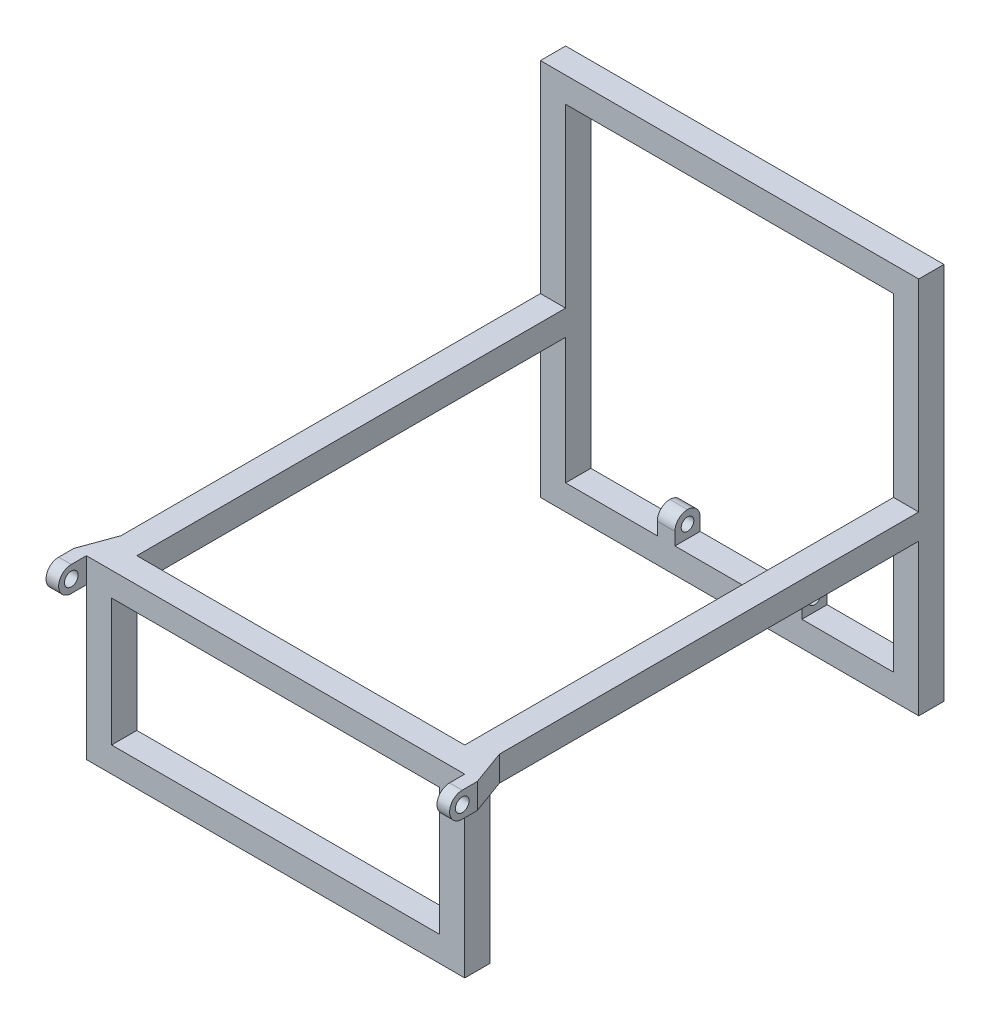
from build123d import *

# Parameters (mm, degrees)
SALIENTE_EXTRUIR1_DEPTH = 750
CORTAR_EXTRUIR4_REACH   = 2536.265
CROQUIS3_W              = 1300
CROQUIS3_H              = 1300
CORTAR_EXTRUIR5_REACH   = 2536.265
CROQUIS4_W              = 1300
CROQUIS4_H              = 504.649156168
CROQUIS5_R              = 27.184697772
SALIENTE_EXTRUIR2_DEPTH = 50
SALIENTE_EXTRUIR3_DEPTH = 100
CROQUIS8_R              = 27.1845
SALIENTE_EXTRUIR4_DEPTH = 50
SALIENTE_EXTRUIR5_DEPTH = 100
CROQUIS11_W             = 70
CROQUIS11_H             = 100
SALIENTE_EXTRUIR6_DEPTH = 100
REDONDEO1_R             = 50
CORTAR_EXTRUIR6_REACH   = 2735.316
CROQUIS12_R             = 25


with BuildPart() as part:
    # Croquis1 → Saliente-Extruir1 (new, symmetric)
    with BuildSketch(Plane(origin=(0, 0, 0), x_dir=(0, 0, -1), z_dir=(1, 0, 0))):
        Polygon((-100, 700), (-100, 1500), (0, 1500), (0, 0), (-100, 0), (-100, 600), (-1800, 600), (-1800, 0), (-1900, 0), (-1900, 600), (-1900, 700), align=None)
    extrude(amount=SALIENTE_EXTRUIR1_DEPTH, both=True)

    # Cortar-Extruir4: up to this face of the body (flat: up to its plane)
    cortar_extruir4_end = Plane(part.part.faces().sort_by_distance((0, 300, 1800))[0])
    # Croquis3 → Cortar-Extruir4 (cut, up to the picked face)
    with BuildSketch(Plane(origin=(0, 0, 0), x_dir=(-1, 0, 0), z_dir=(0, 0, -1)), mode=Mode.PRIVATE) as cortar_extruir4_sk1:
        with Locations((0, 750)):
            Rectangle(CROQUIS3_W, CROQUIS3_H)
    cortar_extruir4_tool1 = split(extrude(cortar_extruir4_sk1.sketch, amount=-CORTAR_EXTRUIR4_REACH, mode=Mode.PRIVATE), bisect_by=cortar_extruir4_end, keep=Keep.BOTH, mode=Mode.PRIVATE)
    add(cortar_extruir4_tool1.solids().sort_by(Axis((0, 750, 0), (0, 0, 1)))[0], mode=Mode.SUBTRACT)

    # Croquis4 → Cortar-Extruir5 (cut, up to next)
    with BuildSketch(Plane.XY.offset(1900), mode=Mode.PRIVATE) as cortar_extruir5_sk1:
        with Locations((0, 352.324578084)):
            Rectangle(CROQUIS4_W, CROQUIS4_H)
    cortar_extruir5_tool1 = extrude(cortar_extruir5_sk1.sketch, amount=-CORTAR_EXTRUIR5_REACH, mode=Mode.PRIVATE) & part.part
    add(cortar_extruir5_tool1.solids().sort_by_distance((0, 352.324578, 1900))[0], mode=Mode.SUBTRACT)



with BuildPart() as body_2:
    # Croquis5 → Saliente-Extruir2 (new body)
    with BuildSketch(Plane(origin=(750, 0, 0), x_dir=(0, 0, -1), z_dir=(1, 0, 0))):
        with BuildLine():
            Line((-1960, 600), (-1900, 600))
            Line((-1900, 600), (-1900, 700))
            Line((-1900, 700), (-1960, 700))
            ThreePointArc((-1960, 700), (-2010, 650), (-1960, 600))
        make_face()
        with Locations((-1960, 650)):
            Circle(CROQUIS5_R, mode=Mode.SUBTRACT)
    extrude(amount=SALIENTE_EXTRUIR2_DEPTH)


with BuildPart() as part_1:
    add(part.part)

    add(body_2.part)  # Saliente-Extruir3 merges body 2
    # Croquis6 → Saliente-Extruir3 (add)
    with BuildSketch(Plane(origin=(0, 700, 0), x_dir=(1, 0, 0), z_dir=(0, 1, 0))):
        Polygon((750, -1900), (800, -1900), (750, -1762.626129027), align=None)
    extrude(amount=-SALIENTE_EXTRUIR3_DEPTH)



with BuildPart() as body_2_2:
    # Croquis8 → Saliente-Extruir4 (new body)
    with BuildSketch(Plane.ZY.offset(750)):
        with BuildLine():
            Line((1960, 700), (1900, 700))
            Line((1900, 700), (1900, 600))
            Line((1900, 600), (1960, 600))
            ThreePointArc((1960, 600), (2010, 650), (1960, 700))
        make_face()
        with Locations((1960, 650)):
            Circle(CROQUIS8_R, mode=Mode.SUBTRACT)
    extrude(amount=SALIENTE_EXTRUIR4_DEPTH)


with BuildPart() as part_2:
    add(part_1.part)

    add(body_2_2.part)  # Saliente-Extruir5 merges body 2 2
    # Croquis9 → Saliente-Extruir5 (add)
    with BuildSketch(Plane(origin=(0, 700, 0), x_dir=(1, 0, 0), z_dir=(0, 1, 0))):
        Polygon((-750, -1900), (-800, -1900), (-750, -1762.626129027), align=None)
    extrude(amount=-SALIENTE_EXTRUIR5_DEPTH)

    # Croquis11 → Saliente-Extruir6 (add)
    with BuildSketch(Plane(origin=(0, 0, 0), x_dir=(-1, 0, 0), z_dir=(0, 0, -1))):
        with Locations((-251.7, 150)):
            Rectangle(CROQUIS11_W, CROQUIS11_H)
        with Locations((251.7, 150)):
            Rectangle(CROQUIS11_W, CROQUIS11_H)
    extrude(amount=-SALIENTE_EXTRUIR6_DEPTH)

    # Redondeo1
    redondeo1_edges = [part_2.edges().sort_by_distance(p)[0] for p in [
        (251.7, 200, 100),
        (251.7, 200, 0),
        (-251.7, 200, 100),
        (-251.7, 200, 0),
    ]]
    fillet(redondeo1_edges, radius=REDONDEO1_R - 0.0001)  # a hair under: the kernel refuses the full size

    # Cortar-Extruir6: up to this face of the body (flat: up to its plane)
    cortar_extruir6_end = Plane(part_2.part.faces().sort_by_distance((286.7, 145.332525283, 50))[0])
    # Croquis12 → Cortar-Extruir6 (cut, up to the picked face)
    with BuildSketch(Plane.ZY.offset(286.7), mode=Mode.PRIVATE) as cortar_extruir6_sk1:
        with Locations(Location((50, 150, 0), (0, 0, 270))):
            Circle(CROQUIS12_R)
    cortar_extruir6_tool1 = split(extrude(cortar_extruir6_sk1.sketch, amount=-CORTAR_EXTRUIR6_REACH, mode=Mode.PRIVATE), bisect_by=cortar_extruir6_end, keep=Keep.BOTH, mode=Mode.PRIVATE)
    add(cortar_extruir6_tool1.solids().sort_by(Axis((-286.7, 150, 50), (1, 0, 0)))[0], mode=Mode.SUBTRACT)


solid = part_2.part
